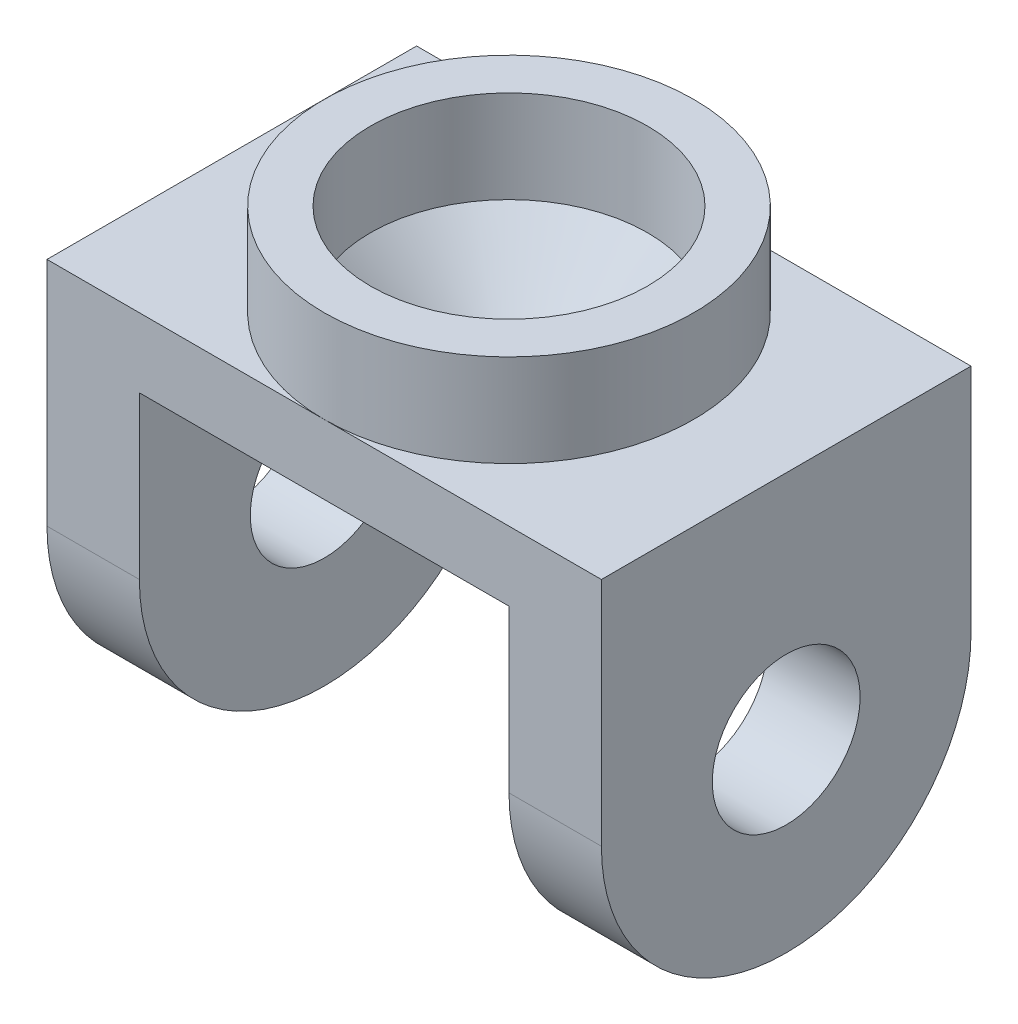
from build123d import *

# Parameters (mm, degrees)
SKETCH1_W           = 304.8
SKETCH1_H           = 203.2
BOSS_EXTRUDE1_DEPTH = 228.6
SKETCH2_R           = 101.6
SKETCH2_R_2         = 76.2
BOSS_EXTRUDE2_DEPTH = 50.8
SKETCH3_R           = 38.1
CUT_EXTRUDE1_DEPTH  = 38.1
SKETCH4_W           = 203.2
SKETCH4_H           = 203.2
CUT_EXTRUDE2_DEPTH  = 190.5
SKETCH5_R           = 40.64
CUT_EXTRUDE3_DEPTH  = 304.8
FILLET1_R           = 101.6
CHAMFER1_SIZE       = 38.1


with BuildPart() as part:
    # Sketch1 → Boss-Extrude1 (new body)
    with BuildSketch(Plane(origin=(0, 0, 0), x_dir=(1, 0, 0), z_dir=(0, 1, 0))):
        Rectangle(SKETCH1_W, SKETCH1_H)
    extrude(amount=BOSS_EXTRUDE1_DEPTH)

    # Sketch2 → Boss-Extrude2 (add)
    with BuildSketch(Plane(origin=(0, 228.6, 0), x_dir=(1, 0, 0), z_dir=(0, 1, 0))):
        with Locations(Location((0, 0, 0), (0, 0, 270))):
            Circle(SKETCH2_R)
        with Locations(Location((0, 0, 0), (0, 0, 270))):
            Circle(SKETCH2_R_2, mode=Mode.SUBTRACT)
    extrude(amount=BOSS_EXTRUDE2_DEPTH)

    # Sketch3 → Cut-Extrude1 (cut)
    with BuildSketch(Plane(origin=(0, 228.6, 0), x_dir=(1, 0, 0), z_dir=(0, 1, 0))):
        with Locations(Location((0, 0, 0), (0, 0, 270))):
            Circle(SKETCH3_R)
    extrude(amount=-CUT_EXTRUDE1_DEPTH, mode=Mode.SUBTRACT)

    # Sketch4 → Cut-Extrude2 (cut)
    with BuildSketch(Plane.XZ):
        Rectangle(SKETCH4_W, SKETCH4_H)
    extrude(amount=-CUT_EXTRUDE2_DEPTH, mode=Mode.SUBTRACT)

    # Sketch5 → Cut-Extrude3 (cut)
    with BuildSketch(Plane(origin=(152.4, 0, 0), x_dir=(0, 0, -1), z_dir=(1, 0, 0))):
        with Locations((0, 101.6)):
            Circle(SKETCH5_R)
    extrude(amount=-CUT_EXTRUDE3_DEPTH, mode=Mode.SUBTRACT)

    # Fillet1
    fillet1_edges = [part.edges().sort_by_distance(p)[0] for p in [
        (127, 0, -101.6),
        (127, 0, 101.6),
        (-127, 0, -101.6),
        (-127, 0, 101.6),
    ]]
    fillet(fillet1_edges, radius=FILLET1_R - 0.0001)  # a hair under: the kernel refuses the full size

    # Chamfer1
    chamfer1_edges = [part.edges().sort_by_distance(p)[0] for p in [
        (0, 228.6, -38.1),
    ]]
    chamfer(chamfer1_edges, length=CHAMFER1_SIZE - 0.0001)  # a hair under: the kernel refuses the full size


solid = part.part
